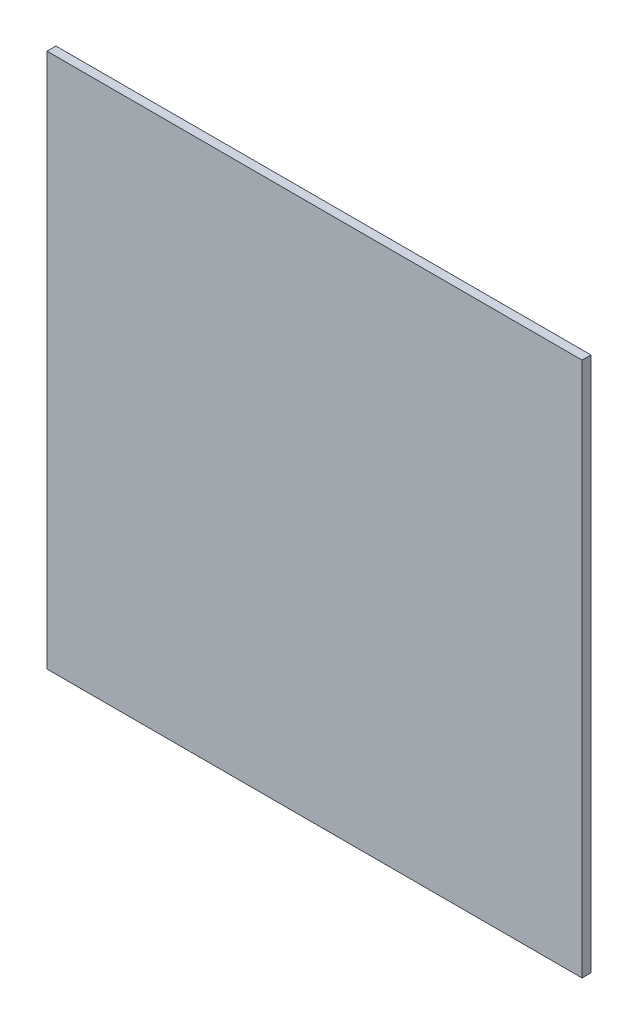
from build123d import *

# Parameters (mm, degrees)
SKIZZE1_W                       = 600
SKIZZE1_H                       = 600
AUFSATZ_LINEAR_AUSTRAGEN1_DEPTH = 10


with BuildPart() as part:
    # Skizze1 → Aufsatz-Linear austragen1 (new body)
    with BuildSketch(Plane.XY):
        Rectangle(SKIZZE1_W, SKIZZE1_H)
    extrude(amount=AUFSATZ_LINEAR_AUSTRAGEN1_DEPTH)


solid = part.part
